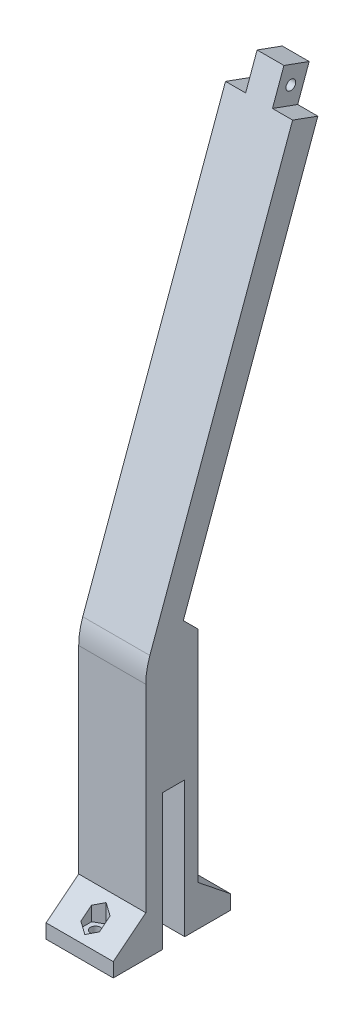
from build123d import *

# Parameters (mm, degrees)
BOSS_EXTRUDE1_DEPTH = 10
CHAMFER1_SIZE       = 7.802060087
CHAMFER1_SIZE_2     = 10
BOSS_EXTRUDE2_DEPTH = 20
SKETCH7_R           = 1.5
CUT_EXTRUDE1_DEPTH  = 20
CUT_EXTRUDE3_DEPTH  = 20
FILLET5_R           = 20
FILLET6_R           = 10
SKETCH10_W          = 5.3
SKETCH10_H          = 4.24
CUT_EXTRUDE4_DEPTH  = 273.805653344
SKETCH11_W          = 3.75
SKETCH11_H          = 144.691495626
CUT_EXTRUDE5_DEPTH  = 370.011076387
BOSS_EXTRUDE4_DEPTH = 12.5
SKETCH12_W          = 2
SKETCH12_H          = 1.5
CUT_EXTRUDE6_DEPTH  = 144.691496
CUT_EXTRUDE7_DEPTH  = 273.805653344
SKETCH15_W          = 8
SKETCH15_H          = 10
BOSS_EXTRUDE5_DEPTH = 8
SKETCH16_R          = 1.45
CUT_EXTRUDE9_DEPTH  = 203.44147603


with BuildPart() as part:
    # Sketch2 → Boss-Extrude1 (new, symmetric)
    with BuildSketch(Plane(origin=(0, 0, 0), x_dir=(0, 0, -1), z_dir=(1, 0, 0))):
        Polygon((36.072931518, 122.5), (-51.279924706, -117.5), (-51.279924706, -192), (-46.279924706, -192), (-46.279924706, -151.5), (-39.679924706, -151.5), (-39.679924706, -192), (-35.679924706, -192), (-35.679924706, -117.5), (-42.766502526, -117.5), (42.766502526, 117.5), (192.766502526, 117.5), (192.766502526, 122.5), align=None)
    extrude(amount=BOSS_EXTRUDE1_DEPTH, both=True)

    # Chamfer1
    # the kernel refuses this chamfer: 10, 7.802060087 mm, written as the material it adds along each edge
    with BuildSketch(Plane(origin=(-10, -117.5, 42.766502526), x_dir=(0, 0.9542611885293297, -0.298974219735734), z_dir=(1, 0, 0))) as chamfer1_piece_1_section:
        Polygon((CHAMFER1_SIZE * 0.998967402661, -CHAMFER1_SIZE * 0.0454326803806), (CHAMFER1_SIZE_2 * 0.298974219736, -CHAMFER1_SIZE_2 * 0.954261188529), (0, 0), align=None)
    chamfer1_piece_1 = extrude(amount=20, mode=Mode.PRIVATE)
    chamfer1_piece_1 = split(chamfer1_piece_1, bisect_by=Plane(origin=(0, -114.855220314, 35.679924706), z_dir=(0, 0, 1)), keep=Keep.TOP, mode=Mode.PRIVATE)
    add(chamfer1_piece_1)

    # Sketch6 → Boss-Extrude2 (add)
    with BuildSketch(Plane(origin=(10, 0, 0), x_dir=(0, 0, -1), z_dir=(1, 0, 0))):
        Polygon((-51.279924706, -180), (-66.279924706, -192), (-51.279924706, -192), align=None)
        Polygon((-35.679924706, -192), (-20.679924706, -192), (-35.679924706, -180), align=None)
    extrude(amount=-BOSS_EXTRUDE2_DEPTH)

    # Sketch7 → Cut-Extrude1 (cut)
    with BuildSketch(Plane(origin=(0, -192, 0), x_dir=(-1, 0, 0), z_dir=(0, -1, 0))):
        with Locations(Location((0, -56.279924706, 0), (0, 0, 90))):
            Circle(SKETCH7_R)
        with Locations(Location((0, -30.179924706, 0), (0, 0, 90))):
            Circle(SKETCH7_R)
    extrude(amount=-CUT_EXTRUDE1_DEPTH, mode=Mode.SUBTRACT)

    # Sketch9 → Cut-Extrude3 (cut)
    with BuildSketch(Plane(origin=(0, -187, 0), x_dir=(-1, 0, 0), z_dir=(0, -1, 0))):
        Polygon((2.75, -57.867637946), (2.75, -54.692211466), (0, -53.104498226), (-2.75, -54.692211466), (-2.75, -57.867637946), (0, -59.455351187), align=None)
        Polygon((2.75, -31.767637946), (2.75, -28.592211466), (0, -27.004498226), (-2.75, -28.592211466), (-2.75, -31.767637946), (0, -33.355351187), align=None)
    extrude(amount=-CUT_EXTRUDE3_DEPTH, mode=Mode.SUBTRACT)

    # Fillet5
    fillet5_edges = [part.edges().sort_by_distance(p)[0] for p in [
        (0, -117.5, 51.279924706),
    ]]
    fillet(fillet5_edges, radius=FILLET5_R)

    # Fillet6
    fillet6_edges = [part.edges().sort_by_distance(p)[0] for p in [
        (0, 122.5, -36.072931518),
    ]]
    fillet(fillet6_edges, radius=FILLET6_R)

    # Sketch10 → Cut-Extrude4 (cut, through all)
    with BuildSketch(Plane(origin=(10, 0, 0), x_dir=(0, 0, -1), z_dir=(1, 0, 0))):
        with Locations((-63.629924706, -189.88)):
            Rectangle(SKETCH10_W, SKETCH10_H)
        with Locations((-23.329924706, -189.88)):
            Rectangle(SKETCH10_W, SKETCH10_H)
    extrude(amount=-CUT_EXTRUDE4_DEPTH, mode=Mode.SUBTRACT)

    # Sketch11 → Cut-Extrude5 (cut, through all)
    with BuildSketch(Plane(origin=(0, 122.5, 0), x_dir=(1, 0, 0), z_dir=(0, 1, 0))):
        with Locations((-8.125, 120.420754713)):
            Rectangle(SKETCH11_W, SKETCH11_H)
        with Locations((8.125, 120.420754713)):
            Rectangle(SKETCH11_W, SKETCH11_H)
    extrude(amount=-CUT_EXTRUDE5_DEPTH, mode=Mode.SUBTRACT)

    # Sketch13 → Boss-Extrude4 (add)
    with BuildSketch(Plane(origin=(6.25, 0, 0), x_dir=(0, 0, -1), z_dir=(1, 0, 0))):
        Polygon((52.766502526, 117.5), (37.766502526, 103.762612903), (42.766502526, 117.5), align=None)
    extrude(amount=-BOSS_EXTRUDE4_DEPTH)

    # Sketch12 → Cut-Extrude6 (cut)
    with BuildSketch(Plane(origin=(0, 0, -192.766502526), x_dir=(-1, 0, 0), z_dir=(0, 0, -1))):
        with Locations((-5.25, 120)):
            Rectangle(SKETCH12_W, SKETCH12_H)
        with Locations((5.25, 120)):
            Rectangle(SKETCH12_W, SKETCH12_H)
    extrude(amount=-CUT_EXTRUDE6_DEPTH, mode=Mode.SUBTRACT)

    # Sketch14 → Cut-Extrude7 (cut, through all)
    with BuildSketch(Plane(origin=(10, 0, 0), x_dir=(0, 0, -1), z_dir=(1, 0, 0))):
        Polygon((-7.517540966, 2.736161147), (0, 0), (208.269452521, 117.586421331), (208.269452521, 129.478082523), (28.535487637, 129.478082523), align=None)
    extrude(amount=-CUT_EXTRUDE7_DEPTH, mode=Mode.SUBTRACT)

    # Sketch15 → Boss-Extrude5 (add)
    with BuildSketch(Plane(origin=(0, 2.736161147, 7.517540966), x_dir=(1, 0, 0), z_dir=(0, 0.3420201433256657, 0.9396926207859096))):
        with Locations((0, 5)):
            Rectangle(SKETCH15_W, SKETCH15_H)
    extrude(amount=-BOSS_EXTRUDE5_DEPTH)

    # Sketch16 → Cut-Extrude9 (cut, through all)
    with BuildSketch(Plane(origin=(10, 0, 0), x_dir=(0, 0, -1), z_dir=(1, 0, 0))):
        with Locations(Location((-2.048669767, 6.066543677, 0), (0, 0, 90))):
            Circle(SKETCH16_R)
    extrude(amount=-CUT_EXTRUDE9_DEPTH, mode=Mode.SUBTRACT)


solid = part.part
